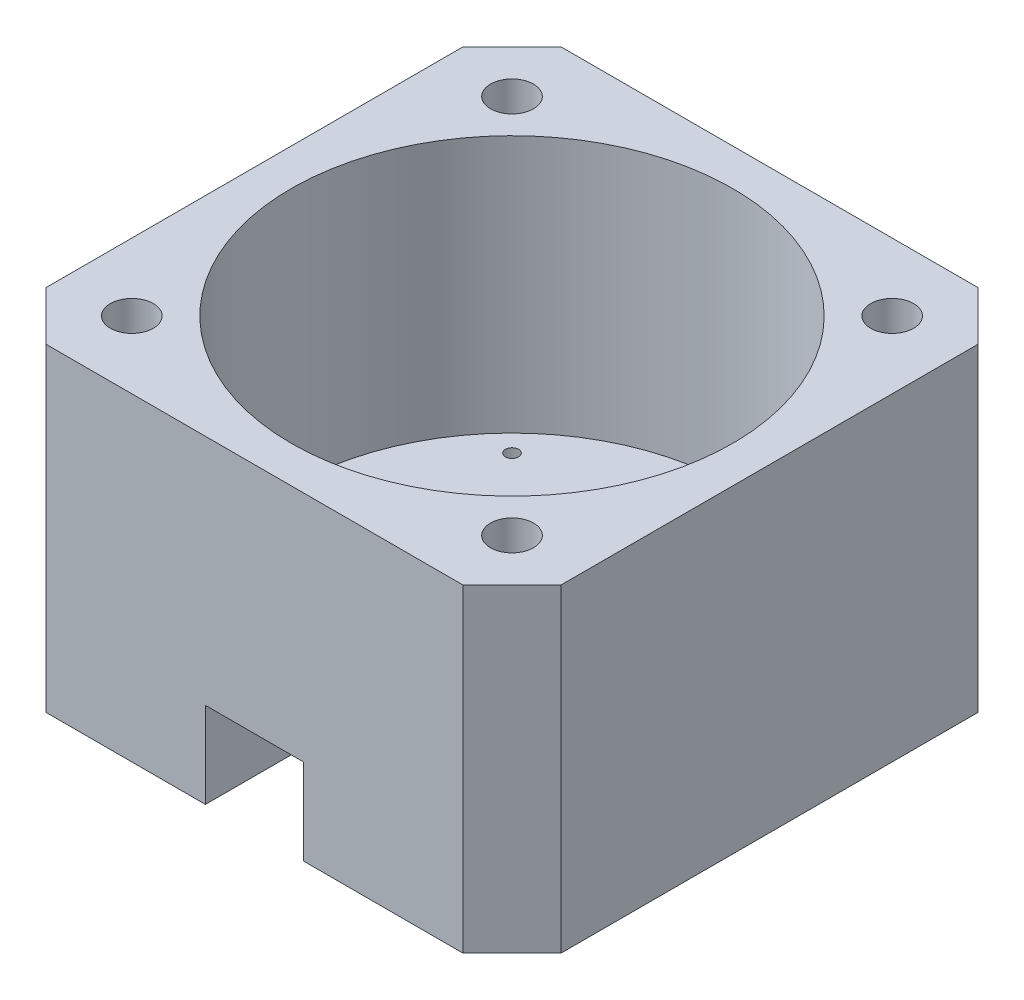
from build123d import *

# Parameters (mm, degrees)
SKETCH_1_W                     = 42
SKETCH_1_H                     = 42
SKETCH_1_R                     = 1.75
EXTRUDE_1_DEPTH                = 26
SKETCH_8_R                     = 6.5
CUT_EXTRUDE_1_DEPTH            = 40.471508712
HOLE_WIZARD_4_4_4_4_1_D        = 4.4
HOLE_WIZARD_4_4_4_4_1_DEPTH    = 4
HOLE_WIZARD_4_4_4_4_1_TIP      = 1.321893362
SKETCH_13_R                    = 18
CUT_EXTRUDE_2_DEPTH            = 21
CHAMFER_1_SIZE                 = 4
SKETCH_14_W                    = 8
SKETCH_14_H                    = 10
CUT_EXTRUDE_3_DEPTH            = 7
HOLE_WIZARD_M2_5_1_D           = 2.7
HOLE_WIZARD_M2_5_1_CBORE_D     = 5
HOLE_WIZARD_M2_5_1_CBORE_DEPTH = 2.5


with BuildPart() as part:
    # 草图1 → 凸台-拉伸1 (new body)
    with BuildSketch(Plane(origin=(0, 0, 0), x_dir=(1, 0, 0), z_dir=(0, 1, 0))):
        Rectangle(SKETCH_1_W, SKETCH_1_H)
        with Locations((-15.5, 15.5)):
            Circle(SKETCH_1_R, mode=Mode.SUBTRACT)
        with Locations((15.5, 15.5)):
            Circle(SKETCH_1_R, mode=Mode.SUBTRACT)
        with Locations((15.5, -15.5)):
            Circle(SKETCH_1_R, mode=Mode.SUBTRACT)
        with Locations((-15.5, -15.5)):
            Circle(SKETCH_1_R, mode=Mode.SUBTRACT)
    extrude(amount=EXTRUDE_1_DEPTH)

    # 草图8 → 切除-拉伸1 (cut, through all)
    with BuildSketch(Plane.XZ):
        Circle(SKETCH_8_R)
    extrude(amount=-CUT_EXTRUDE_1_DEPTH, mode=Mode.SUBTRACT)

    # Ø4.4 (4.4) 直径孔1
    with Locations(Plane.XZ):
        with Locations((-11.313708499, -11.313708499), (-11.313708499, 11.313708499), (11.313708499, -11.313708499), (11.313708499, 11.313708499)):
            Hole(HOLE_WIZARD_4_4_4_4_1_D / 2, depth=HOLE_WIZARD_4_4_4_4_1_DEPTH)
            with Locations((0, 0, -(HOLE_WIZARD_4_4_4_4_1_DEPTH + HOLE_WIZARD_4_4_4_4_1_TIP / 2))):  # 118° drill point
                Cone(0, HOLE_WIZARD_4_4_4_4_1_D / 2, HOLE_WIZARD_4_4_4_4_1_TIP, mode=Mode.SUBTRACT)

    # 草图13 → 切除-拉伸2 (cut)
    with BuildSketch(Plane(origin=(0, 26, 0), x_dir=(1, 0, 0), z_dir=(0, 1, 0))):
        Circle(SKETCH_13_R)
    extrude(amount=-CUT_EXTRUDE_2_DEPTH, mode=Mode.SUBTRACT)

    # 倒角1
    chamfer_1_edges = [part.edges().sort_by_distance(p)[0] for p in [
        (-21, 13, 21),
        (21, 13, 21),
        (21, 13, -21),
        (-21, 13, -21),
    ]]
    chamfer(chamfer_1_edges, length=CHAMFER_1_SIZE)

    # 草图14 → 切除-拉伸3 (cut)
    with BuildSketch(Plane.XZ):
        with Locations((0, 18)):
            Rectangle(SKETCH_14_W, SKETCH_14_H)
    extrude(amount=-CUT_EXTRUDE_3_DEPTH, mode=Mode.SUBTRACT)

    # M2.5 六角圆柱头螺钉的柱形沉头孔1 (through all)
    with Locations(Plane.XZ):
        with Locations((-6.81241073, -6.81241073), (21, 21), (-6.621258192, 6.621258192), (6.621258192, 6.621258192), (6.81241073, -6.81241073)):
            CounterBoreHole(HOLE_WIZARD_M2_5_1_D / 2, HOLE_WIZARD_M2_5_1_CBORE_D / 2, HOLE_WIZARD_M2_5_1_CBORE_DEPTH)


solid = part.part
